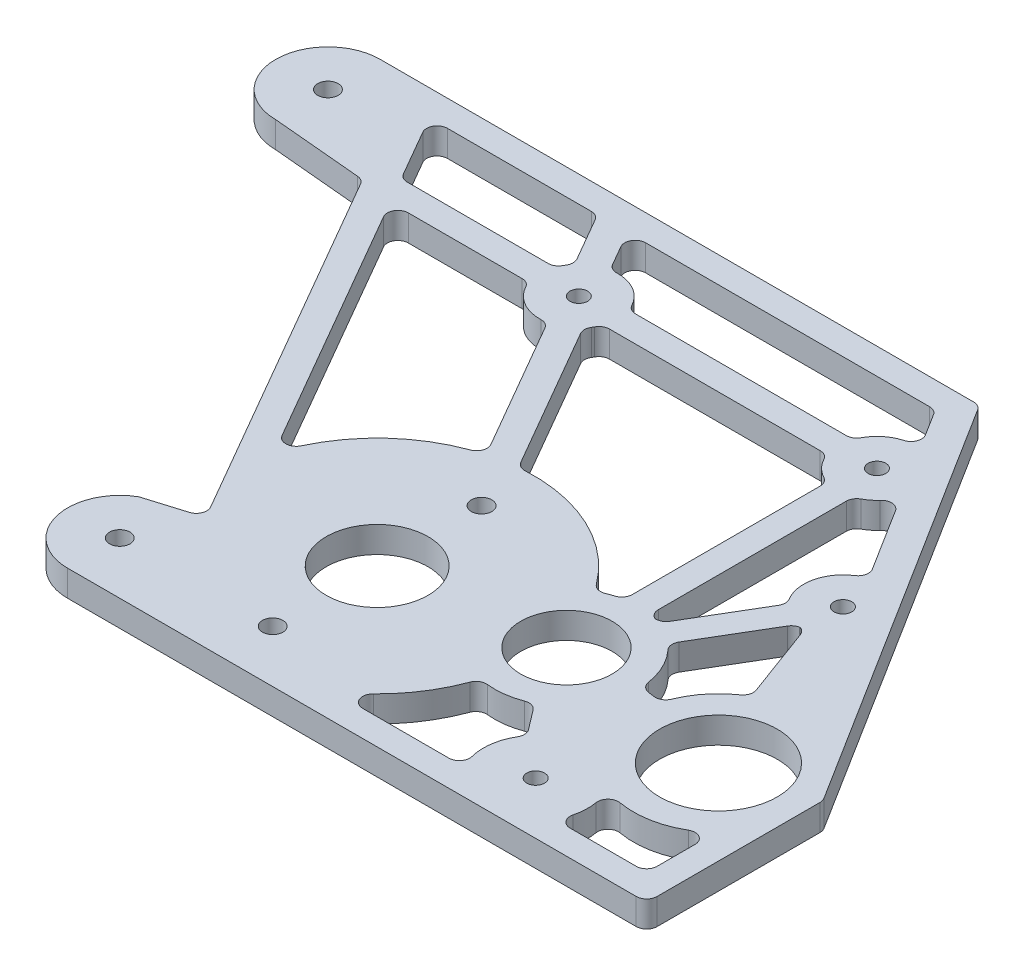
from build123d import *

# Parameters (mm, degrees)
SKETCH1_R           = 2.4892
SKETCH1_R_2         = 14.3002
SKETCH1_R_3         = 11.1252
SKETCH1_R_4         = 12.3825
BOSS_EXTRUDE1_DEPTH = 6.35
SKETCH2_W           = 6.35
SKETCH2_H           = 6.35
SKETCH2_H_2         = 16.217729686
SKETCH2_R           = 2.15265
CUT_EXTRUDE2_DEPTH  = 196.570791382
FILLET1_R           = 2.54


with BuildPart() as part:
    # Sketch1 → Boss-Extrude1 (new body)
    with BuildSketch(Plane(origin=(0, 0, 0), x_dir=(1, 0, 0), z_dir=(0, 1, 0))):
        with BuildLine():
            ThreePointArc((-168.788743889, 72.590962133), (-181.488743889, 59.890962122), (-168.788743866, 47.190962133))
            Line((-168.788743866, 47.190962133), (-145.58139547, 45.094655563))
            Line((-145.58139547, 45.094655563), (-93.510572414, -45.094655563))
            Line((-93.510572414, -45.094655563), (-105.98261767, -48.892439505))
            ThreePointArc((-105.98261767, -48.892439505), (-111.899875664, -63.177964006), (-99.63261767, -72.590962133))
            Line((-99.63261767, -72.590962133), (47.56445351, -72.590962133))
            Line((47.56445351, -72.590962133), (47.56445351, 72.590962133))
            Line((47.56445351, 72.590962133), (-168.788743889, 72.590962133))
        make_face()
        with Locations(Location((-168.788743889, 59.890962133, 0), (0, 0, 270))):
            Circle(SKETCH1_R, mode=Mode.SUBTRACT)
        with Locations(Location((20.56425351, -34.490962133, 0), (0, 0, 270))):
            Circle(SKETCH1_R_2, mode=Mode.SUBTRACT)
        with Locations(Location((-22.22178223, -28.671379192, 0), (0, 0, 270))):
            Circle(SKETCH1_R_3, mode=Mode.SUBTRACT)
        with Locations(Location((-62.44294649, -9.090962133, 0), (0, 0, 270))):
            Circle(SKETCH1_R, mode=Mode.SUBTRACT)
        with Locations(Location((-62.44294649, -34.490962133, 0), (0, 0, 270))):
            Circle(SKETCH1_R_4, mode=Mode.SUBTRACT)
        with Locations(Location((-62.44294649, -59.890962133, 0), (0, 0, 270))):
            Circle(SKETCH1_R, mode=Mode.SUBTRACT)
        with Locations(Location((-99.63261767, -59.890962133, 0), (0, 0, 270))):
            Circle(SKETCH1_R, mode=Mode.SUBTRACT)
    extrude(amount=BOSS_EXTRUDE1_DEPTH)

    # Sketch2 → Cut-Extrude2 (cut, through all)
    with BuildSketch(Plane(origin=(0, 6.35, 0), x_dir=(1, 0, 0), z_dir=(0, 1, 0))):
        Polygon((47.56445351, 66.240962133), (41.21445351, 66.240962133), (41.21445351, 50.023232447), (41.21445351, 43.673232447), (41.21445351, -29.703590933), (47.56445351, -39.813704084), align=None)
        with Locations((44.38945351, 69.415962133)):
            Rectangle(SKETCH2_W, SKETCH2_H)
        with Locations((38.03945351, 58.13209729)):
            Rectangle(SKETCH2_W, SKETCH2_H_2)
        with Locations((38.03945351, 69.415962133)):
            Rectangle(SKETCH2_W, SKETCH2_H)
        Polygon((34.86445351, 72.590962133), (-23.035115437, 72.590962133), (-19.04678223, 66.240962133), (34.86445351, 66.240962133), align=None)
        Polygon((34.86445351, 66.240962133), (-19.04678223, 66.240962133), (-8.860686193, 50.023232447), (34.86445351, 50.023232447), align=None)
        Polygon((34.86445351, 50.023232447), (-8.860686193, 50.023232447), (-4.872352987, 43.673232447), (34.86445351, 43.673232447), align=None)
        with Locations((38.03945351, 46.848232447)):
            Rectangle(SKETCH2_W, SKETCH2_H)
        Polygon((34.86445351, 43.673232447), (-4.872352987, 43.673232447), (10.866061277, 18.615413703), (34.86445351, -19.593477782), align=None)
        with BuildLine():
            Line((41.21445351, 43.673232447), (34.86445351, 43.673232447))
            Line((34.86445351, 43.673232447), (34.86445351, -19.593477782))
            ThreePointArc((34.86445351, -19.593477782), (38.05130715, -23.507624068), (40.193418442, -28.077956276))
            Line((40.193418442, -28.077956276), (41.21445351, -29.703590933))
            Line((41.21445351, -29.703590933), (41.21445351, 43.673232447))
        make_face()
        Polygon((47.56445351, -72.590962133), (47.56445351, -39.813704084), (41.21445351, -29.703590933), (41.21445351, -34.490962133), (41.21445351, -66.240962133), (41.21445351, -72.590962133), align=None)
        with BuildLine():
            ThreePointArc((14.21425351, -59.890962133), (13.781511504, -63.177964006), (12.512776138, -66.240962133))
            Line((12.512776138, -66.240962133), (34.86445351, -66.240962133))
            Line((34.86445351, -66.240962133), (34.86445351, -49.388446484))
            ThreePointArc((34.86445351, -49.388446484), (24.29215872, -54.801882417), (12.486538167, -53.495731926))
            ThreePointArc((12.486538167, -53.495731926), (13.774718737, -56.578713286), (14.21425351, -59.890962133))
        make_face()
        with BuildLine():
            ThreePointArc((-26.036833474, -45.725059119), (-31.933433069, -57.311557893), (-41.382379071, -66.240962133))
            Line((-41.382379071, -66.240962133), (-9.484269118, -66.240962133))
            ThreePointArc((-9.484269118, -66.240962133), (-11.152631367, -58.974431983), (-8.455564218, -52.023768575))
            Line((-8.455564218, -52.023768575), (-14.348733734, -44.272588197))
            ThreePointArc((-14.348733734, -44.272588197), (-20.066729245, -46.013188834), (-26.036833474, -45.725059119))
        make_face()
        with BuildLine():
            ThreePointArc((2.936724983, 4.025278528), (1.940142116, 4.063195995), (0.952986623, 4.205108568))
            Line((0.952986623, 4.205108568), (-10.729224972, -15.506891252))
            ThreePointArc((-10.729224972, -15.506891252), (-6.488632291, -21.065420473), (-4.766304695, -27.841367715))
            Line((-4.766304695, -27.841367715), (0.773671741, -28.594892827))
            ThreePointArc((0.773671741, -28.594892827), (4.454113042, -21.572210873), (10.509484328, -16.45398964))
            Line((10.509484328, -16.45398964), (2.936724983, 4.025278528))
        make_face()
        with BuildLine():
            Line((-0.032923472, 22.643237608), (-13.241526109, 43.673232447))
            ThreePointArc((-13.241526109, 43.673232447), (-15.48659014, 40.113040356), (-19.04678223, 37.867976326))
            Line((-19.04678223, 37.867976326), (-19.04678223, -11.487026133))
            ThreePointArc((-19.04678223, -11.487026133), (-17.602770585, -11.817674956), (-16.191951442, -12.269435535))
            Line((-16.191951442, -12.269435535), (-4.509739846, 7.442564285))
            ThreePointArc((-4.509739846, 7.442564285), (-6.336897432, 16.240268394), (-0.032923472, 22.643237608))
        make_face()
        with BuildLine():
            Line((-87.499696821, 40.658602514), (-66.012373687, 3.441467126))
            ThreePointArc((-66.012373687, 3.441467126), (-46.037667348, -0.103801502), (-30.714155868, -13.398455272))
            ThreePointArc((-30.714155868, -13.398455272), (-28.133236556, -12.226400542), (-25.39678223, -11.487026133))
            Line((-25.39678223, -11.487026133), (-25.39678223, 37.867976326))
            ThreePointArc((-25.39678223, 37.867976326), (-28.956974321, 40.113040356), (-31.202038352, 43.673232447))
            Line((-31.202038352, 43.673232447), (-85.759199418, 43.673232447))
            ThreePointArc((-85.759199418, 43.673232447), (-86.490563568, 42.085732447), (-87.499696821, 40.658602514))
        make_face()
        with BuildLine():
            Line((-25.39678223, 63.026148158), (-27.415955353, 66.240962133))
            Line((-27.415955353, 66.240962133), (-102.269679034, 66.240962133))
            Line((-102.269679034, 66.240962133), (-96.479952942, 56.21286238))
            ThreePointArc((-96.479952942, 56.21286238), (-89.976955539, 55.097124418), (-85.759199418, 50.023232447))
            Line((-85.759199418, 50.023232447), (-31.202038352, 50.023232447))
            ThreePointArc((-31.202038352, 50.023232447), (-28.956974321, 53.583424538), (-25.39678223, 55.828488568))
            Line((-25.39678223, 55.828488568), (-25.39678223, 63.026148158))
        make_face()
        with BuildLine():
            Line((-109.602027453, 66.240962133), (-150.457872842, 66.240962133))
            Line((-150.457872842, 66.240962133), (-141.094562242, 50.023232447))
            Line((-141.094562242, 50.023232447), (-103.71971166, 50.023232447))
            ThreePointArc((-103.71971166, 50.023232447), (-102.98834751, 51.610732447), (-101.979214256, 53.03786238))
            Line((-101.979214256, 53.03786238), (-109.602027453, 66.240962133))
        make_face()
        with BuildLine():
            Line((-103.71971166, 43.673232447), (-137.428388033, 43.673232447))
            Line((-137.428388033, 43.673232447), (-98.827143013, -23.186085162))
            ThreePointArc((-98.827143013, -23.186085162), (-88.972030152, -7.144706081), (-72.639137705, 2.219359096))
            Line((-72.639137705, 2.219359096), (-92.998958135, 37.483602514))
            ThreePointArc((-92.998958135, 37.483602514), (-99.501955539, 38.599340476), (-103.71971166, 43.673232447))
        make_face()
        with Locations(Location((-94.739455539, 46.848232447, 0), (0, 0, 270))):
            Circle(SKETCH2_R)
        with Locations(Location((-22.22178223, 46.848232447, 0), (0, 0, 270))):
            Circle(SKETCH2_R)
        with BuildLine():
            Line((-21.182472547, 56.31636111), (-25.39678223, 63.026148158))
            Line((-25.39678223, 63.026148158), (-25.39678223, 55.828488568))
            ThreePointArc((-25.39678223, 55.828488568), (-23.317135227, 56.310041302), (-21.182472547, 56.31636111))
        make_face()
        with Locations(Location((2.800077171, 13.549298288, 0), (0, 0, 270))):
            Circle(SKETCH2_R)
        with Locations(Location((1.51425351, -59.890962133, 0), (0, 0, 270))):
            Circle(SKETCH2_R)
        with BuildLine():
            ThreePointArc((40.193418442, -28.077956276), (38.05130715, -23.507624068), (34.86445351, -19.593477782))
            Line((34.86445351, -19.593477782), (40.193418442, -28.077956276))
        make_face()
    extrude(amount=-CUT_EXTRUDE2_DEPTH, mode=Mode.SUBTRACT)

    # Fillet1
    # the kernel refuses this fillet: 2.54 mm, written as the material it adds along each edge
    with BuildSketch(Plane(origin=(-0.032923472, 6.35, -22.643237608), x_dir=(-0.5318756266132327, 0, -0.8468224830593369), z_dir=(0, -1, 0))) as fillet1_piece_1:
        with BuildLine():
            CenterArc((2.856810834, -2.54), FILLET1_R, 90, 89.514635236)
            ThreePointArc((0.31690197, -2.518483376), (0.242721388, -1.248637903), (0, 0))
            Line((0, 0), (2.856810834, 0))
        make_face()
    extrude(amount=6.35)
    with BuildSketch(Plane(origin=(-4.509739846, 6.35, -7.442564285), x_dir=(-0.5098355459445677, 0, 0.8602718849825355), z_dir=(0, -1, 0)), Plane(origin=(-25.39678223, 6.35, -37.867976326), x_dir=(0, 0, 1), z_dir=(0, -1, 0)), Plane(origin=(-85.759199418, 6.35, -43.673232447), x_dir=(1, 0, 0), z_dir=(0, -1, 0)), Plane(origin=(-103.71971166, 6.35, -50.023232447), x_dir=(-1, 0, 0), z_dir=(0, -1, 0)), Plane(origin=(-92.998958135, 6.35, -37.483602514), x_dir=(0.4999999999999684, 0, 0.8660254037844568), z_dir=(0, -1, 0)), Plane(origin=(-31.202038352, 6.35, -50.023232447), x_dir=(-1, 0, 0), z_dir=(0, -1, 0)), Plane(origin=(-96.479952942, 6.35, -56.21286238), x_dir=(-0.5000000000000201, 0, -0.8660254037844269), z_dir=(0, -1, 0)), Plane(origin=(2.936724983, 6.35, -4.025278528), x_dir=(0.3468247817060115, 0, 0.9379299391716727), z_dir=(0, -1, 0))) as fillet1_piece_2:
        with BuildLine():
            CenterArc((1.645326216, 2.54), FILLET1_R, 208.273713631, 61.726286369)
            ThreePointArc((-0.591638487, 1.336842105), (-0.270133815, 0.679788504), (0, 0))
            Line((0, 0), (1.645326216, 0))
        make_face()
    extrude(amount=6.35)
    with BuildSketch(Plane(origin=(-16.191951442, 6.35, 12.269435535), x_dir=(-0.9556721820552411, 0, -0.29443281142864175), z_dir=(0, -1, 0)), Plane(origin=(-25.39678223, 6.35, 11.487026133), x_dir=(-0.9722502226407506, 0, 0.23394337899374487), z_dir=(0, -1, 0)), Plane(origin=(-4.766304695, 6.35, 27.841367715), x_dir=(-0.10077394544841023, 0, -0.9949093485935092), z_dir=(0, -1, 0))) as fillet1_piece_3:
        with BuildLine():
            CenterArc((2.002192205, 2.536375191), FILLET1_R, 193.529346775, 73.409289119)
            Line((-0.46732336, 1.942159009), (0, 0))
            ThreePointArc((0, 0), (0.933271163, 0.024938685), (1.866542327, 0))
        make_face()
    extrude(amount=6.35)
    with BuildSketch(Plane(origin=(-19.04678223, 6.35, 11.487026133), x_dir=(0, 0, -1), z_dir=(0, -1, 0)), Plane(origin=(-14.348733734, 6.35, 44.272588197), x_dir=(0.6052311902996638, 0, 0.7960497511389927), z_dir=(0, -1, 0)), Plane(origin=(-10.729224972, 6.35, 15.506891252), x_dir=(0.5098355459445673, 0, -0.8602718849825356), z_dir=(0, -1, 0))) as fillet1_piece_4:
        with BuildLine():
            CenterArc((1.997591734, 2.54), FILLET1_R, 196.590710881, 73.409289119)
            ThreePointArc((-0.436665219, 1.814746193), (-0.194085968, 0.913207337), (0, 0))
            Line((0, 0), (1.997591734, 0))
        make_face()
    extrude(amount=6.35)
    with BuildSketch(Plane(origin=(-19.04678223, 6.35, -37.867976326), x_dir=(0.9144485360750629, 0, -0.40470220517088157), z_dir=(0, -1, 0)), Plane(origin=(-31.202038352, 6.35, -43.673232447), x_dir=(0.4047022051709391, 0, 0.9144485360750374), z_dir=(0, -1, 0)), Plane(origin=(-103.71971166, 6.35, -43.673232447), x_dir=(0.404702205170935, 0, 0.9144485360750392), z_dir=(0, -1, 0)), Plane(origin=(-85.759199418, 6.35, -50.023232447), x_dir=(-0.4047022051709323, 0, -0.9144485360750405), z_dir=(0, -1, 0)), Plane(origin=(0.952986623, 6.35, -4.205108568), x_dir=(0.9930059355670856, 0, 0.1180644397290607), z_dir=(0, -1, 0))) as fillet1_piece_5:
        with BuildLine():
            CenterArc((1.656832134, 2.532509751), FILLET1_R, 203.872467133, 61.726286369)
            Line((-0.665867148, 1.50456615), (0, 0))
            ThreePointArc((0, 0), (0.730955353, 0.028088435), (1.461910706, 0))
        make_face()
    extrude(amount=6.35)
    with BuildSketch(Plane(origin=(-13.241526109, 6.35, -43.673232447), x_dir=(0.5318756266132512, 0, 0.8468224830593254), z_dir=(0, -1, 0))) as fillet1_piece_6:
        with BuildLine():
            CenterArc((4.118007212, 2.54), FILLET1_R, 163.750788387, 106.249211613)
            ThreePointArc((1.679470802, 3.250732142), (0.997294731, 1.543964011), (0, 0))
            Line((0, 0), (4.118007212, 0))
        make_face()
    extrude(amount=6.35)
    with BuildSketch(Plane(origin=(-30.714155868, 6.35, 13.398455272), x_dir=(-0.5761425270353003, 0, -0.8173492451463928), z_dir=(0, -1, 0))) as fillet1_piece_7:
        with BuildLine():
            CenterArc((2.150079499, 2.539052885), FILLET1_R, 192.691000149, 75.744283125)
            ThreePointArc((-0.327865925, 1.981032747), (-0.135455723, 0.995229429), (0, 0))
            ThreePointArc((0, 0), (1.040361048, 0.014206732), (2.080722096, 0))
        make_face()
    extrude(amount=6.35)
    with BuildSketch(Plane(origin=(-66.012373687, 6.35, -3.441467126), x_dir=(-0.49999999999999895, 0, -0.8660254037844394), z_dir=(0, -1, 0))) as fillet1_piece_8:
        with BuildLine():
            CenterArc((1.593244673, 2.54), FILLET1_R, 206.94435818, 63.05564182)
            ThreePointArc((-0.671030679, 1.3890625), (-0.328484302, 0.697927816), (0, 0))
            Line((0, 0), (1.593244673, 0))
        make_face()
    extrude(amount=6.35)
    with BuildSketch(Plane(origin=(-87.499696821, 6.35, -40.658602514), x_dir=(0.5000000000000445, 0, 0.8660254037844128), z_dir=(0, -1, 0)), Plane(origin=(-101.979214256, 6.35, -53.03786238), x_dir=(-0.4999999999999449, 0, -0.8660254037844705), z_dir=(0, -1, 0))) as fillet1_piece_9:
        with BuildLine():
            CenterArc((1.645326216, -2.54), FILLET1_R, 90, 61.726286369)
            ThreePointArc((-0.591638487, -1.336842105), (-0.270133815, -0.679788504), (0, 0))
            Line((0, 0), (1.645326216, 0))
        make_face()
    extrude(amount=6.35)
    with BuildSketch(Plane(origin=(-141.094562242, 6.35, -50.023232447), x_dir=(-0.4999999999999992, 0, -0.8660254037844392), z_dir=(0, -1, 0)), Plane(origin=(-109.602027453, 6.35, -66.240962133), x_dir=(0.4999999999999971, 0, 0.8660254037844404), z_dir=(0, -1, 0))) as fillet1_piece_10:
        with BuildLine():
            CenterArc((FILLET1_R * 0.57735026919, FILLET1_R), FILLET1_R, 210, 60)
            Line((-FILLET1_R * 0.288675134595, FILLET1_R * 0.5), (0, 0))
            Line((0, 0), (FILLET1_R * 0.57735026919, 0))
        make_face()
    extrude(amount=6.35)
    with BuildSketch(Plane(origin=(-150.457872842, 6.35, -66.240962133), x_dir=(1, 0, 0), z_dir=(0, -1, 0)), Plane(origin=(-137.428388033, 6.35, -43.673232447), x_dir=(1, 0, 0), z_dir=(0, -1, 0)), Plane(origin=(-102.269679034, 6.35, -66.240962133), x_dir=(1, 0, 0), z_dir=(0, -1, 0))) as fillet1_piece_11:
        with BuildLine():
            CenterArc((FILLET1_R * 1.73205080757, FILLET1_R), FILLET1_R, 150, 120)
            Line((FILLET1_R * 0.866025403784, FILLET1_R * 1.5), (0, 0))
            Line((0, 0), (FILLET1_R * 1.73205080757, 0))
        make_face()
    extrude(amount=6.35)
    with BuildSketch(Plane(origin=(-72.639137705, 6.35, -2.219359096), x_dir=(-0.4999999999999954, 0, -0.8660254037844414), z_dir=(0, -1, 0))) as fillet1_piece_12:
        with BuildLine():
            CenterArc((3.145060303, -2.54), FILLET1_R, 90, 99.896853443)
            ThreePointArc((0.642858636, -2.9765625), (0.3511794, -1.481856021), (0, 0))
            Line((0, 0), (3.145060303, 0))
        make_face()
    extrude(amount=6.35)
    with BuildSketch(Plane(origin=(-98.827143013, 6.35, 23.186085162), x_dir=(-0.5000000000000507, 0, -0.8660254037844094), z_dir=(0, -1, 0))) as fillet1_piece_13:
        with BuildLine():
            CenterArc((5.302990058, 2.54), FILLET1_R, 144.98785915, 125.01214085)
            ThreePointArc((3.222652623, 3.997325), (1.678741036, 1.944312593), (0, 0))
            Line((0, 0), (5.302990058, 0))
        make_face()
    extrude(amount=6.35)
    with BuildSketch(Plane(origin=(-21.182472547, 6.35, -56.31636111), x_dir=(-0.5318756266132614, 0, -0.8468224830593191), z_dir=(0, -1, 0))) as fillet1_piece_14:
        with BuildLine():
            CenterArc((4.118007212, -2.54), FILLET1_R, 90, 106.249211613)
            ThreePointArc((1.679470802, -3.250732142), (0.997294731, -1.543964011), (0, 0))
            Line((0, 0), (4.118007212, 0))
        make_face()
    extrude(amount=6.35)
    with BuildSketch(Plane(origin=(-27.415955353, 6.35, -66.240962133), x_dir=(0.5318756266132484, 0, 0.8468224830593272), z_dir=(0, -1, 0))) as fillet1_piece_15:
        with BuildLine():
            CenterArc((FILLET1_R * 0.552801068408, FILLET1_R), FILLET1_R, 212.132271171, 57.867728829)
            Line((-FILLET1_R * 0.294021414652, FILLET1_R * 0.468124373387), (0, 0))
            Line((0, 0), (FILLET1_R * 0.552801068408, 0))
        make_face()
    extrude(amount=6.35)
    with BuildSketch(Plane(origin=(-93.510572414, 0, 45.094655563), x_dir=(-0.4999999999999942, 0, -0.866025403784442), z_dir=(0, 1, 0))) as fillet1_piece_16:
        with BuildLine():
            CenterArc((FILLET1_R * 1.2586215929, FILLET1_R), FILLET1_R, 166.93568657, 103.06431343)
            Line((FILLET1_R * 0.284504645203, FILLET1_R * 1.22604462438), (0, 0))
            Line((0, 0), (FILLET1_R * 1.2586215929, 0))
        make_face()
    extrude(amount=6.35)
    with BuildSketch(Plane(origin=(-145.58139547, 0, -45.094655563), x_dir=(-0.9959450943810714, 0, -0.08996315344783558), z_dir=(0, 1, 0))) as fillet1_piece_17:
        with BuildLine():
            CenterArc((FILLET1_R * 0.518777228691, FILLET1_R), FILLET1_R, 215.16148734, 54.83851266)
            Line((-FILLET1_R * 0.298754947094, FILLET1_R * 0.424117076519), (0, 0))
            Line((0, 0), (FILLET1_R * 0.518777228691, 0))
        make_face()
    extrude(amount=6.35)
    with BuildSketch(Plane(origin=(12.512776138, 6.35, 66.240962133), x_dir=(1, 0, 0), z_dir=(0, -1, 0))) as fillet1_piece_18:
        with BuildLine():
            CenterArc((3.757543921, -2.54), FILLET1_R, 90, 104.477512186)
            ThreePointArc((1.298199496, -3.175), (0.756785248, -1.543469366), (0, 0))
            Line((0, 0), (3.757543921, 0))
        make_face()
    extrude(amount=6.35)
    with BuildSketch(Plane(origin=(12.486538167, 6.35, 53.495731926), x_dir=(0.9587523268645184, 0, 0.2842428112228552), z_dir=(0, -1, 0))) as fillet1_piece_19:
        with BuildLine():
            CenterArc((4.973256038, 2.523603909), FILLET1_R, 153.808037206, 109.678306586)
            ThreePointArc((2.694062493, 3.64470907), (1.510934745, 1.701201856), (0, 0))
            ThreePointArc((0, 0), (2.342559188, 0.133300222), (4.685118376, 0))
        make_face()
    extrude(amount=6.35)
    with BuildSketch(Plane(origin=(34.86445351, 6.35, 49.388446484), x_dir=(0, 0, 1), z_dir=(0, -1, 0))) as fillet1_piece_20:
        with BuildLine():
            CenterArc((5.089588271, 2.54), FILLET1_R, 149.527856693, 120.472143307)
            ThreePointArc((2.90042369, 3.828083242), (1.561881562, 1.829432831), (0, 0))
            Line((0, 0), (5.089588271, 0))
        make_face()
    extrude(amount=6.35)
    with BuildSketch(Plane(origin=(34.86445351, 6.35, 66.240962133), x_dir=(-1, 0, 0), z_dir=(0, -1, 0))) as fillet1_piece_21:
        with BuildLine():
            CenterArc((FILLET1_R, FILLET1_R), FILLET1_R, 180, 90)
            Line((0, FILLET1_R), (0, 0))
            Line((0, 0), (FILLET1_R, 0))
        make_face()
    extrude(amount=6.35)
    with BuildSketch(Plane(origin=(-8.455564218, 6.35, 52.023768575), x_dir=(-0.5664581250472787, 0, 0.8240905244983232), z_dir=(0, -1, 0))) as fillet1_piece_22:
        with BuildLine():
            CenterArc((1.838749898, 2.534493607), FILLET1_R, 198.250912511, 67.975687163)
            Line((-0.573473214, 1.73901912), (0, 0))
            ThreePointArc((0, 0), (0.835795408, 0.027531967), (1.671590816, 0))
        make_face()
    extrude(amount=6.35)
    with BuildSketch(Plane(origin=(-9.484269118, 6.35, 66.240962133), x_dir=(-1, 0, 0), z_dir=(0, -1, 0))) as fillet1_piece_23:
        with BuildLine():
            CenterArc((3.757543921, 2.54), FILLET1_R, 165.522487814, 104.477512186)
            ThreePointArc((1.298199496, 3.175), (0.756785248, 1.543469366), (0, 0))
            Line((0, 0), (3.757543921, 0))
        make_face()
    extrude(amount=6.35)
    with BuildSketch(Plane(origin=(-41.382379071, 6.35, 66.240962133), x_dir=(1, 0, 0), z_dir=(0, -1, 0))) as fillet1_piece_24:
        with BuildLine():
            CenterArc((7.195148817, -2.54), FILLET1_R, 90, 135.951374326)
            ThreePointArc((5.429166552, -4.365625), (2.814575743, -2.058460144), (0, 0))
            Line((0, 0), (7.195148817, 0))
        make_face()
    extrude(amount=6.35)
    with BuildSketch(Plane(origin=(-26.036833474, 6.35, 45.725059119), x_dir=(0.9868095938718356, 0, 0.16188522305171205), z_dir=(0, -1, 0))) as fillet1_piece_25:
        with BuildLine():
            CenterArc((2.153909615, 2.535804562), FILLET1_R, 190.962129112, 75.744283125)
            ThreePointArc((-0.33974323, 2.052797842), (-0.155855544, 1.028718616), (0, 0))
            ThreePointArc((0, 0), (1.00399039, 0.028864616), (2.007980779, 0))
        make_face()
    extrude(amount=6.35)
    with BuildSketch(Plane(origin=(10.509484328, 6.35, 16.45398964), x_dir=(-0.34682478170601116, 0, -0.9379299391716728), z_dir=(0, -1, 0))) as fillet1_piece_26:
        with BuildLine():
            CenterArc((2.070307568, -2.54), FILLET1_R, 90, 75.73303264)
            ThreePointArc((-0.391353681, -1.914041621), (-0.173029092, -0.961651472), (0, 0))
            Line((0, 0), (2.070307568, 0))
        make_face()
    extrude(amount=6.35)
    with BuildSketch(Plane(origin=(0.773671741, 6.35, 28.594892827), x_dir=(-0.9908762329901363, 0, -0.13477496390382493), z_dir=(0, -1, 0))) as fillet1_piece_27:
        with BuildLine():
            CenterArc((2.070307568, 2.54), FILLET1_R, 194.26696736, 75.73303264)
            ThreePointArc((-0.391353681, 1.914041621), (-0.173029092, 0.961651472), (0, 0))
            Line((0, 0), (2.070307568, 0))
        make_face()
    extrude(amount=6.35)
    # the kernel refuses this fillet: 2.54 mm, written as the material it takes off along each edge
    with BuildSketch(Plane(origin=(-23.035115437, 9.860286784, -72.590962133), x_dir=(-1, 0, 0), z_dir=(0, -1, 0))) as fillet1_2_piece_1:
        with BuildLine():
            CenterArc((FILLET1_R * 0.552801068408, -FILLET1_R), FILLET1_R, 90, 57.867728829)
            Line((-FILLET1_R * 0.294021414652, -FILLET1_R * 0.468124373387), (0, 0))
            Line((0, 0), (FILLET1_R * 0.552801068408, 0))
        make_face()
    extrude(amount=13.370573569, mode=Mode.SUBTRACT)
    with BuildSketch(Plane(origin=(41.21445351, 12.7, 72.590962133), x_dir=(0, 0, -1), z_dir=(0, -1, 0))) as fillet1_2_piece_2:
        with BuildLine():
            CenterArc((FILLET1_R, -FILLET1_R), FILLET1_R, 90, 90)
            Line((0, -FILLET1_R), (0, 0))
            Line((0, 0), (FILLET1_R, 0))
        make_face()
    extrude(amount=19.05, mode=Mode.SUBTRACT)
    with BuildSketch(Plane(origin=(41.21445351, 8.178768201, 29.703590933), x_dir=(-0.5318756266132559, 0, -0.8468224830593225), z_dir=(0, -1, 0))) as fillet1_2_piece_3:
        with BuildLine():
            CenterArc((FILLET1_R * 0.287994992205, -FILLET1_R), FILLET1_R, 90, 32.132271171)
            Line((-FILLET1_R * 0.243880634408, -FILLET1_R * 0.153177516941), (0, 0))
            Line((0, 0), (FILLET1_R * 0.287994992205, 0))
        make_face()
    extrude(amount=10.007536401, mode=Mode.SUBTRACT)


solid = part.part
